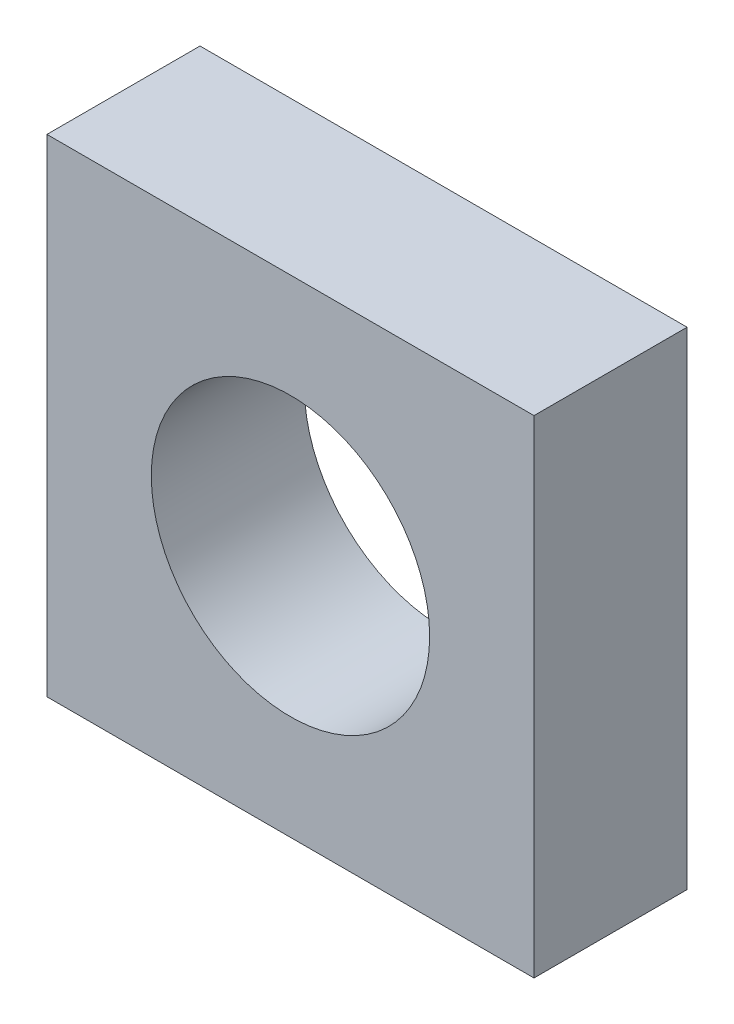
from build123d import *

# Parameters (mm, degrees)
SKETCH_1_W        = 7
SKETCH_1_H        = 7
EXTRUDE_1_DEPTH   = 2.2
OTHER_1_OUTLINE_R = 2
OTHER_1_DEPTH     = 2.2


# Read off the part's stored shape, not the designer's step: Отверстие1
with BuildPart() as part:
    # Эскиз1 → Бобышка-Вытянуть1 (new body)
    with BuildSketch(Plane.XY):
        Rectangle(SKETCH_1_W, SKETCH_1_H)
    extrude(amount=EXTRUDE_1_DEPTH)

    # Отверстие1 outline → Отверстие1 (cut)
    with BuildSketch(Plane.XY):
        with Locations((0.000165228, 0.001845922)):
            Circle(OTHER_1_OUTLINE_R)
    extrude(amount=OTHER_1_DEPTH, mode=Mode.SUBTRACT)


solid = part.part
